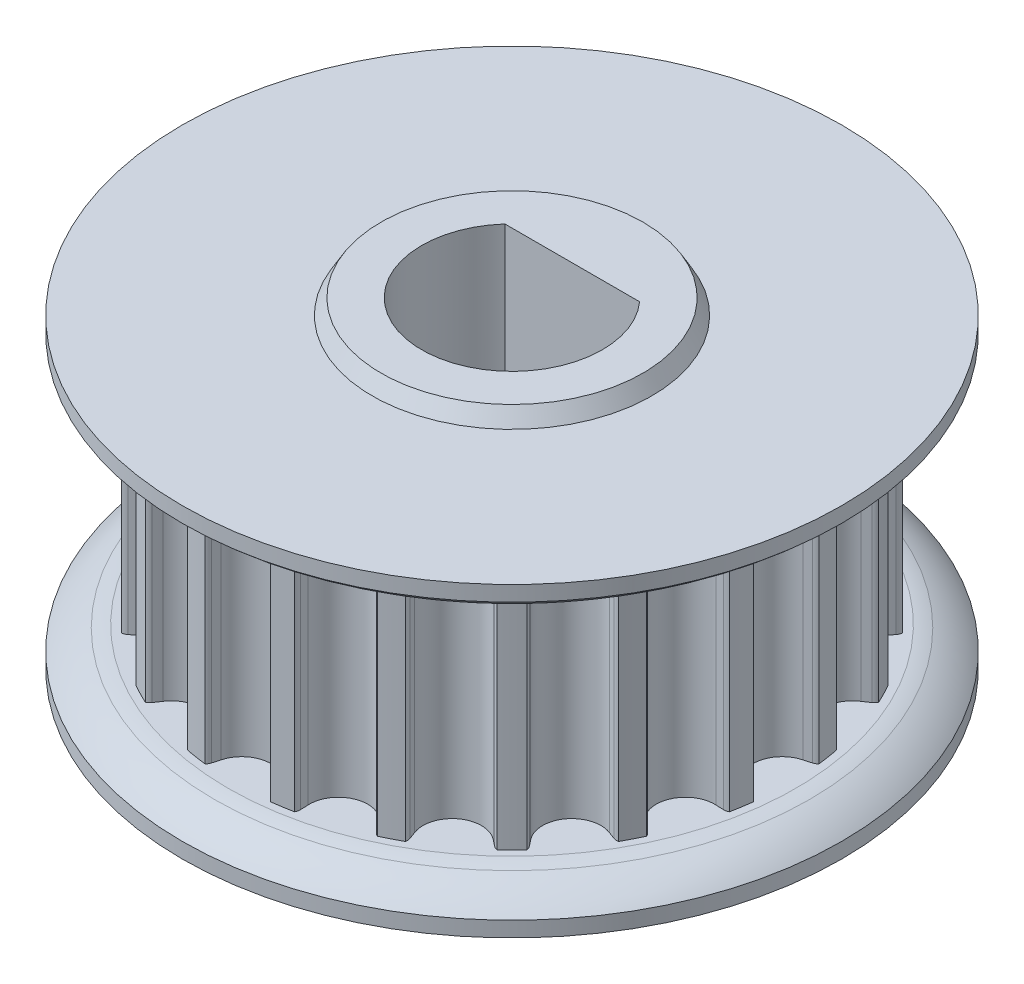
from build123d import *

# Parameters (mm, degrees)
SKETCH1_R           = 9.168296891
TOOTHOD_DEPTH       = 3.81
TOOTHPROFILE_DEPTH  = 14.514119867
TOOTHPATTERN_COUNT  = 20
SKETCH6_W           = 5.08
SKETCH6_H           = 0.508
BORE_DEPTH          = 17.458085407
BORE_DEPTH_BACK     = 17.458085407
SKETCH7_R           = 3
BOSS_EXTRUDE2_DEPTH = 8.001
CHAMFER1_SIZE       = 1.27
CHAMFER1_SIZE_2     = 0.733234842


with BuildPart() as part:
    # Sketch1 → ToothOD (new, symmetric)
    with BuildSketch(Plane(origin=(0, 0, 0), x_dir=(1, 0, 0), z_dir=(0, 1, 0))):
        with Locations(Location((0, 0, 0), (0, 0, 90))):
            Circle(SKETCH1_R)
    extrude(amount=TOOTHOD_DEPTH, both=True)

    # Sketch2 → ToothProfile (cut, symmetric)
    with BuildSketch(Plane(origin=(0, 0, 0), x_dir=(1, 0, 0), z_dir=(0, 1, 0))):
        with BuildLine():
            ThreePointArc((-0.937033068, 8.718358887), (-0.590385173, 8.200184277), (0, 7.999896891))
            ThreePointArc((0, 7.999896891), (0.590385173, 8.200184277), (0.937033068, 8.718358887))
            ThreePointArc((0.937033068, 8.718358887), (0.971699064, 8.844470349), (1.007805813, 8.970176891))
            ThreePointArc((1.007805813, 8.970176891), (1.039709124, 9.042165511), (1.089260141, 9.10336093))
            ThreePointArc((1.089260141, 9.10336093), (0, 9.168296891), (-1.089260141, 9.10336093))
            ThreePointArc((-1.089260141, 9.10336093), (-1.039709124, 9.042165511), (-1.007805813, 8.970176891))
            ThreePointArc((-1.007805813, 8.970176891), (-0.971699064, 8.844470349), (-0.937033068, 8.718358887))
        make_face()
    toothprofile = extrude(amount=TOOTHPROFILE_DEPTH, both=True, mode=Mode.SUBTRACT)

    # ToothPattern: ToothProfile ×20 about axis
    toothpattern_axis = Axis((0, 0, 0), (0, 1, 0))
    for i in range(1, TOOTHPATTERN_COUNT):
        add(toothprofile.rotate(toothpattern_axis, i * 360 / TOOTHPATTERN_COUNT), mode=Mode.SUBTRACT)

    # Sketch4 → Flange (revolve)
    with BuildSketch(Plane.XY, mode=Mode.PRIVATE) as flange_sk:
        with BuildLine():
            Line((0, -3.81), (9.422296891, -3.81))
            ThreePointArc((9.422296891, -3.81), (9.651943512, -3.845951298), (9.877369219, -3.902637424))
            ThreePointArc((9.877369219, -3.902637424), (10.445097796, -4.184197125), (10.946296891, -4.572))
            Line((10.946296891, -4.572), (10.946296891, -5.08))
            Line((10.946296891, -5.08), (0, -5.08))
            Line((0, -5.08), (0, -3.81))
        make_face()
        with BuildLine():
            Line((10.946296891, 5.08), (10.946296891, 4.572))
            ThreePointArc((10.946296891, 4.572), (10.445097796, 4.184197125), (9.877369219, 3.902637424))
            ThreePointArc((9.877369219, 3.902637424), (9.651943512, 3.845951298), (9.422296891, 3.81))
            Line((9.422296891, 3.81), (0, 3.81))
            Line((0, 3.81), (0, 5.08))
            Line((0, 5.08), (10.946296891, 5.08))
        make_face()
    revolve(flange_sk.sketch.rotate(Axis((0, 8.73125, 0), (0, -1, 0)), 90), axis=Axis((0, 8.73125, 0), (0, -1, 0)))

    # Sketch6 → TopBearingBoss (revolve)
    with BuildSketch(Plane.XY, mode=Mode.PRIVATE) as topbearingboss_sk:
        with Locations((2.54, 5.334)):
            Rectangle(SKETCH6_W, SKETCH6_H)
    topbearingboss = revolve(topbearingboss_sk.sketch.rotate(Axis((0, 8.73125, 0), (0, -1, 0)), 90), axis=Axis((0, 8.73125, 0), (0, -1, 0)))

    # BottomBearingBoss: TopBearingBoss across plane
    add(topbearingboss.mirror(Plane.ZX))

    # Sketch7 → Bore (cut, two sides: drawn at the far end of the back side and taken through both)
    with BuildSketch(Plane.XZ.offset(-BORE_DEPTH_BACK)):
        with Locations(Location((0, 0, 0), (0, 0, 270))):
            Circle(SKETCH7_R)
    extrude(amount=BORE_DEPTH + BORE_DEPTH_BACK, mode=Mode.SUBTRACT)

    # Sketch8 → Boss-Extrude2 (add)
    with BuildSketch(Plane(origin=(0, 5.588, 0), x_dir=(1, 0, 0), z_dir=(0, 1, 0))):
        with BuildLine():
            Line((-2.236067977, 2), (2.236067977, 2))
            ThreePointArc((2.236067977, 2), (0, 3), (-2.236067977, 2))
        make_face()
    extrude(amount=-BOSS_EXTRUDE2_DEPTH)

    # Chamfer1
    # the kernel refuses this chamfer: 1.27, 0.733234842 mm, written as the material it takes off along each edge
    with BuildSketch(Plane(origin=(0, 5.588, 0), x_dir=(0, 0, 1), z_dir=(1, 0, 0))) as chamfer1_piece_1_section:
        Polygon((5.08, CHAMFER1_SIZE), (5.08 - CHAMFER1_SIZE_2, 0), (5.08, 0), align=None)
    chamfer1_piece_1 = revolve(axis=Axis((0, 5.588, 0), (0, -1, 0)), mode=Mode.PRIVATE)
    chamfer1_piece_1 = split(chamfer1_piece_1, bisect_by=Plane(origin=(0, 5.08, -4.499394908), z_dir=(0, 1, 0)), keep=Keep.TOP, mode=Mode.PRIVATE)
    add(chamfer1_piece_1, mode=Mode.SUBTRACT)
    with BuildSketch(Plane(origin=(0, -5.588, 0), x_dir=(0, 0, 1), z_dir=(1, 0, 0))) as chamfer1_piece_2_section:
        Polygon((5.08 - CHAMFER1_SIZE, 0), (5.08, -CHAMFER1_SIZE_2), (5.08, 0), align=None)
    chamfer1_piece_2 = revolve(axis=Axis((0, -5.588, 0), (0, -1, 0)), mode=Mode.PRIVATE)
    chamfer1_piece_2 = split(chamfer1_piece_2, bisect_by=Plane(origin=(0, -5.08, -4.239907911), z_dir=(0, -1, 0)), keep=Keep.TOP, mode=Mode.PRIVATE)
    add(chamfer1_piece_2, mode=Mode.SUBTRACT)


solid = part.part
